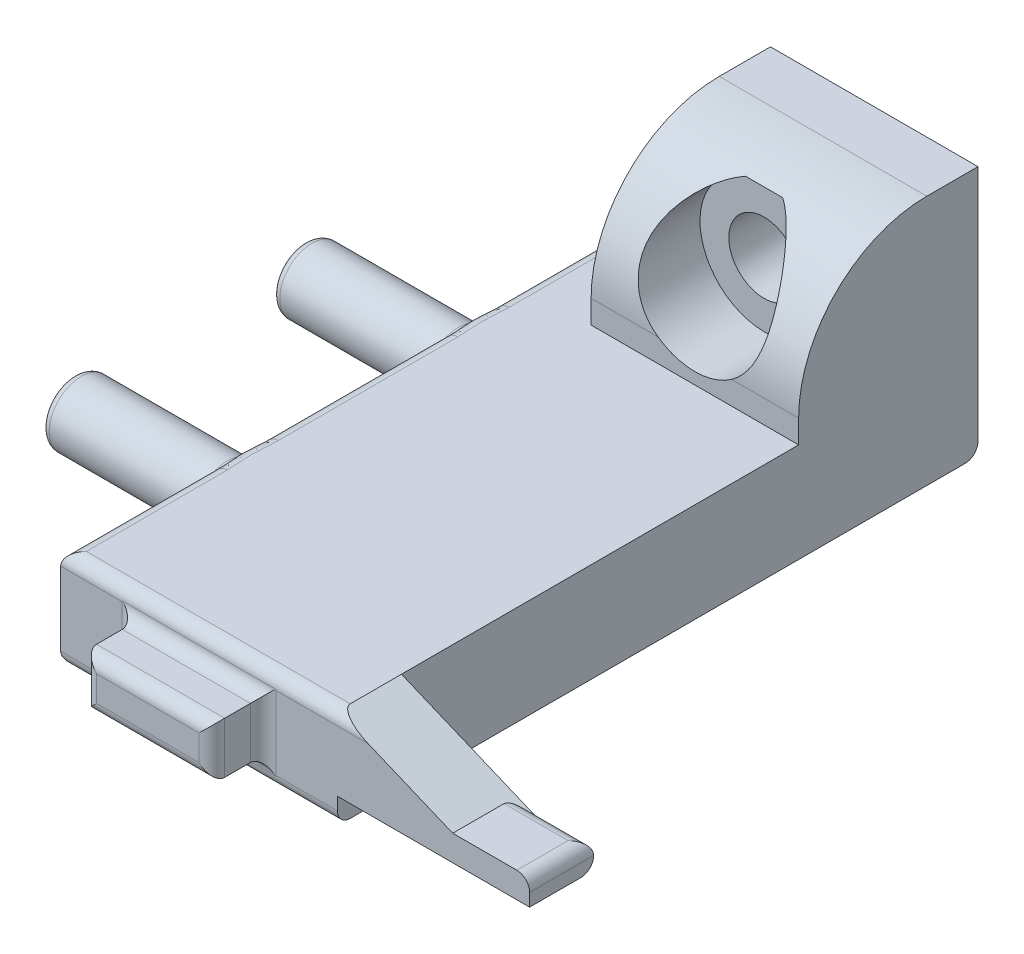
from build123d import *

# Parameters (mm, degrees)
ESQUISSE1_W                                       = 21.6
ESQUISSE1_H                                       = 50
BOSS_EXTRU_1_DEPTH                                = 3.875
BOSS_EXTRU_2_DEPTH                                = 16.2
CHAMBRAGE_POUR_VIS_SIX_PANS_CREUX_M51_D           = 5.5
CHAMBRAGE_POUR_VIS_SIX_PANS_CREUX_M51_CBORE_D     = 10
CHAMBRAGE_POUR_VIS_SIX_PANS_CREUX_M51_CBORE_DEPTH = 5.4
ESQUISSE3_R                                       = 1.125
ENL_V_MAT_EXTRU_1_DEPTH                           = 4
ESQUISSE9_R                                       = 2.5
BOSS_EXTRU_3_DEPTH                                = 13
ESQUISSE10_W                                      = 10
ESQUISSE10_H                                      = 4
BOSS_EXTRU_4_DEPTH                                = 4
ESQUISSE11_W                                      = 5
ESQUISSE11_H                                      = 2
BOSS_EXTRU_5_DEPTH                                = 15
BOSS_EXTRU_6_DEPTH                                = 5
CONG_1_R                                          = 0.6
CONG_2_R                                          = 1
CONG_3_R                                          = 1
CONG_4_R                                          = 1


# Some blends are built 0.0001 mm under size
with BuildPart() as part:
    # Esquisse1 → Boss.-Extru.1 (new, symmetric)
    with BuildSketch(Plane(origin=(0, 0, 0), x_dir=(1, 0, 0), z_dir=(0, 1, 0))):
        Rectangle(ESQUISSE1_W, ESQUISSE1_H)
    extrude(amount=BOSS_EXTRU_1_DEPTH, both=True)

    # Esquisse2 → Boss.-Extru.2 (add)
    with BuildSketch(Plane(origin=(10.8, 0, 0), x_dir=(0, 0, -1), z_dir=(1, 0, 0))):
        with BuildLine():
            Line((25, 3.875), (25, 15.685))
            Line((25, 15.685), (21, 15.685))
            ThreePointArc((21, 15.685), (13.928932188, 12.756067812), (11, 5.685))
            Line((11, 5.685), (11, 3.875))
            Line((11, 3.875), (25, 3.875))
        make_face()
    extrude(amount=-BOSS_EXTRU_2_DEPTH)

    # Chambrage pour vis à six pans creux M51 (through all)
    with Locations(Plane.XY.offset(-11)):
        with Locations((2.7, 9.7795)):
            CounterBoreHole(CHAMBRAGE_POUR_VIS_SIX_PANS_CREUX_M51_D / 2, CHAMBRAGE_POUR_VIS_SIX_PANS_CREUX_M51_CBORE_D / 2, CHAMBRAGE_POUR_VIS_SIX_PANS_CREUX_M51_CBORE_DEPTH)

    # Esquisse3 → Enlèv. mat.-Extru.1 (cut)
    with BuildSketch(Plane(origin=(0, 0, -25), x_dir=(-1, 0, 0), z_dir=(0, 0, -1))):
        with Locations((1.55, 9.7795)):
            Circle(ESQUISSE3_R)
    extrude(amount=-ENL_V_MAT_EXTRU_1_DEPTH, mode=Mode.SUBTRACT)

    # Esquisse9 → Boss.-Extru.3 (add)
    with BuildSketch(Plane.ZY.offset(10.8)):
        with Locations(Location((-7, 0, 0), (0, 0, 180))):
            Circle(ESQUISSE9_R)
        with Locations(Location((11, 0, 0), (0, 0, 180))):
            Circle(ESQUISSE9_R)
    extrude(amount=BOSS_EXTRU_3_DEPTH)

    # Esquisse10 → Boss.-Extru.4 (add)
    with BuildSketch(Plane.XY.offset(25)):
        Rectangle(ESQUISSE10_W, ESQUISSE10_H)
    extrude(amount=BOSS_EXTRU_4_DEPTH)

    # Esquisse11 → Boss.-Extru.5 (add)
    with BuildSketch(Plane(origin=(10.8, 0, 0), x_dir=(0, 0, -1), z_dir=(1, 0, 0))):
        with Locations((-22.5, -0.875)):
            Rectangle(ESQUISSE11_W, ESQUISSE11_H)
    extrude(amount=BOSS_EXTRU_5_DEPTH)

    # Esquisse12 → Boss.-Extru.6 (add)
    with BuildSketch(Plane(origin=(0, 0, 20), x_dir=(-1, 0, 0), z_dir=(0, 0, -1))):
        Polygon((-10.8, 0.125), (-19.8, 0.125), (-10.8, 3.875), align=None)
    extrude(amount=-BOSS_EXTRU_6_DEPTH)

    # Congé1
    cong_1_edges = [part.edges().sort_by_distance(p)[0] for p in [
        (-23.8, 0, -4.5),
        (-23.8, 0, 13.5),
    ]]
    fillet(cong_1_edges, radius=CONG_1_R)

    # Congé2
    cong_2_edges = [part.edges().sort_by_distance(p)[0] for p in [
        (-10.8, 0, -4.5),
        (-10.8, 0, 13.5),
    ]]
    fillet(cong_2_edges, radius=CONG_2_R)

    # Congé3
    cong_3_edges = [part.edges().sort_by_distance(p)[0] for p in [
        (0, -3.875, -25),
        (0, -3.875, 25),
        (0, 3.875, 25),
        (-10.8, -3.875, 0),
        (-10.8, 0, -25),
        (-10.8, 3.875, 0),
        (-8.1, 3.875, -25),
        (25.8, 0.125, 22.5),
        (22.8, 0.125, 20),
        (18.3, -1.875, 20),
    ]]
    fillet(cong_3_edges, radius=CONG_3_R - 0.0001)  # a hair under: the kernel refuses the full size

    # Congé4
    # the kernel refuses this fillet: 1 mm, written as the material it adds along each edge
    with BuildSketch(Plane(origin=(-5, -2, 25), x_dir=(-1, 0, 0), z_dir=(0, 1, 0)), Plane(origin=(5, 2, 25), x_dir=(1, 0, 0), z_dir=(0, -1, 0))) as cong_4_piece_1:
        with BuildLine():
            CenterArc((CONG_4_R, CONG_4_R), CONG_4_R, 180, 90)
            Line((0, CONG_4_R), (-CONG_4_R * 0.02, CONG_4_R))
            Line((-CONG_4_R * 0.02, CONG_4_R), (-CONG_4_R * 0.02, -CONG_4_R * 0.02))
            Line((-CONG_4_R * 0.02, -CONG_4_R * 0.02), (CONG_4_R, -CONG_4_R * 0.02))
            Line((CONG_4_R, -CONG_4_R * 0.02), (CONG_4_R, 0))
        make_face()
    cong_4_piece_1_solid = extrude(amount=4, mode=Mode.PRIVATE)
    with BuildSketch(Plane(origin=(5, -2, 25), x_dir=(0, -0.9999978327920384, -0.0020819248849580653), z_dir=(-1, 0, 0)), Plane(origin=(-5, 2, 25), x_dir=(0, 0.9999978327920382, -0.0020819248849618536), z_dir=(1, 0, 0))) as cong_4_piece_2:
        with BuildLine():
            CenterArc((0.997924036, 0.998175758), CONG_4_R, 180.119285595, 86.419369433)
            Line((-0.002073797, 0.996093833), (-0.10207358, 0.995885641))
            Line((-0.10207358, 0.995885641), (-0.099999783, -0.000208192))
            Line((-0.099999783, -0.000208192), (0.000208192, -0.099999783))
            ThreePointArc((0.000208192, -0.099999783), (0.875306296, -0.098177891), (0.931511397, -0.099817576))
            Line((0.931511397, -0.099817576), (0.937548909, 0))
        make_face()
    cong_4_piece_2_solid = extrude(amount=10, mode=Mode.PRIVATE)
    with BuildSketch(Plane(origin=(5, -2, 25), x_dir=(0, -0.9999978327920384, -0.0020819248849580653), z_dir=(-1, 0, 0))) as cong_4_piece_3a_section:
        with BuildLine():
            CenterArc((0.997924036, 0.998175758), CONG_4_R, 180.119285595, 86.419369433)
            Line((-0.002073797, 0.996093833), (-0.10207358, 0.995885641))
            Line((-0.10207358, 0.995885641), (-0.099999783, -0.000208192))
            Line((-0.099999783, -0.000208192), (0.000208192, -0.099999783))
            ThreePointArc((0.000208192, -0.099999783), (0.875306296, -0.098177891), (0.931511397, -0.099817576))
            Line((0.931511397, -0.099817576), (0.937548909, 0))
        make_face()
    cong_4_piece_3a = extrude(amount=12.49023998, mode=Mode.PRIVATE)
    cong_4_piece_3a = split(cong_4_piece_3a, bisect_by=Plane(origin=(-5, -2.205066251, 25.227606846), z_dir=(-1, 0, 0)), keep=Keep.TOP, mode=Mode.PRIVATE)
    with BuildSketch(Plane(origin=(-5, -4.5, 25), x_dir=(-1, 0, 0), z_dir=(0, 1, 0))) as cong_4_piece_3b_section:
        with BuildLine():
            CenterArc((CONG_4_R, CONG_4_R), CONG_4_R, 180, 90)
            Line((0, CONG_4_R), (-CONG_4_R * 0.02, CONG_4_R))
            Line((-CONG_4_R * 0.02, CONG_4_R), (-CONG_4_R * 0.02, -CONG_4_R * 0.02))
            Line((-CONG_4_R * 0.02, -CONG_4_R * 0.02), (CONG_4_R, -CONG_4_R * 0.02))
            Line((CONG_4_R, -CONG_4_R * 0.02), (CONG_4_R, 0))
        make_face()
    cong_4_piece_3b = extrude(amount=6.5, mode=Mode.PRIVATE)
    cong_4_piece_3b = split(cong_4_piece_3b, bisect_by=Plane(origin=(-5.226395114, -2, 25.226395114), z_dir=(0, -1, 0)), keep=Keep.TOP, mode=Mode.PRIVATE)
    cong_4_piece_3 = cong_4_piece_3a & cong_4_piece_3b
    with BuildSketch(Plane(origin=(-7.49023998, 2, 25), x_dir=(0, 0.9999978327920382, -0.0020819248849618536), z_dir=(1, 0, 0))) as cong_4_piece_4a_section:
        with BuildLine():
            CenterArc((0.997924036, 0.998175758), CONG_4_R, 180.119285595, 86.419369433)
            Line((-0.002073797, 0.996093833), (-0.10207358, 0.995885641))
            Line((-0.10207358, 0.995885641), (-0.099999783, -0.000208192))
            Line((-0.099999783, -0.000208192), (0.000208192, -0.099999783))
            ThreePointArc((0.000208192, -0.099999783), (0.875306296, -0.098177891), (0.931511397, -0.099817576))
            Line((0.931511397, -0.099817576), (0.937548909, 0))
        make_face()
    cong_4_piece_4a = extrude(amount=12.49023998, mode=Mode.PRIVATE)
    cong_4_piece_4a = split(cong_4_piece_4a, bisect_by=Plane(origin=(-5, 2.205066251, 25.227606846), z_dir=(-1, 0, 0)), keep=Keep.TOP, mode=Mode.PRIVATE)
    with BuildSketch(Plane(origin=(-5, -2, 25), x_dir=(-1, 0, 0), z_dir=(0, 1, 0))) as cong_4_piece_4b_section:
        with BuildLine():
            CenterArc((CONG_4_R, CONG_4_R), CONG_4_R, 180, 90)
            Line((0, CONG_4_R), (-CONG_4_R * 0.02, CONG_4_R))
            Line((-CONG_4_R * 0.02, CONG_4_R), (-CONG_4_R * 0.02, -CONG_4_R * 0.02))
            Line((-CONG_4_R * 0.02, -CONG_4_R * 0.02), (CONG_4_R, -CONG_4_R * 0.02))
            Line((CONG_4_R, -CONG_4_R * 0.02), (CONG_4_R, 0))
        make_face()
    cong_4_piece_4b = extrude(amount=6.5, mode=Mode.PRIVATE)
    cong_4_piece_4b = split(cong_4_piece_4b, bisect_by=Plane(origin=(-5.226395114, 2, 25.226395114), z_dir=(0, 1, 0)), keep=Keep.TOP, mode=Mode.PRIVATE)
    cong_4_piece_4 = cong_4_piece_4a & cong_4_piece_4b
    with BuildSketch(Plane(origin=(7.49023998, -2, 25), x_dir=(0, -0.9999978327920382, -0.002081924884961854), z_dir=(-1, 0, 0))) as cong_4_piece_5a_section:
        with BuildLine():
            CenterArc((0.997924036, 0.998175758), CONG_4_R, 180.119285595, 86.419369433)
            Line((-0.002073797, 0.996093833), (-0.10207358, 0.995885641))
            Line((-0.10207358, 0.995885641), (-0.099999783, -0.000208192))
            Line((-0.099999783, -0.000208192), (0.000208192, -0.099999783))
            ThreePointArc((0.000208192, -0.099999783), (0.875306296, -0.098177891), (0.931511397, -0.099817576))
            Line((0.931511397, -0.099817576), (0.937548909, 0))
        make_face()
    cong_4_piece_5a = extrude(amount=12.49023998, mode=Mode.PRIVATE)
    cong_4_piece_5a = split(cong_4_piece_5a, bisect_by=Plane(origin=(5, -2.205066251, 25.227606846), z_dir=(1, 0, 0)), keep=Keep.TOP, mode=Mode.PRIVATE)
    with BuildSketch(Plane(origin=(5, 2, 25), x_dir=(1, 0, 0), z_dir=(0, -1, 0))) as cong_4_piece_5b_section:
        with BuildLine():
            CenterArc((CONG_4_R, CONG_4_R), CONG_4_R, 180, 90)
            Line((0, CONG_4_R), (-CONG_4_R * 0.02, CONG_4_R))
            Line((-CONG_4_R * 0.02, CONG_4_R), (-CONG_4_R * 0.02, -CONG_4_R * 0.02))
            Line((-CONG_4_R * 0.02, -CONG_4_R * 0.02), (CONG_4_R, -CONG_4_R * 0.02))
            Line((CONG_4_R, -CONG_4_R * 0.02), (CONG_4_R, 0))
        make_face()
    cong_4_piece_5b = extrude(amount=6.5, mode=Mode.PRIVATE)
    cong_4_piece_5b = split(cong_4_piece_5b, bisect_by=Plane(origin=(5.226395114, -2, 25.226395114), z_dir=(0, -1, 0)), keep=Keep.TOP, mode=Mode.PRIVATE)
    cong_4_piece_5 = cong_4_piece_5a & cong_4_piece_5b
    with BuildSketch(Plane(origin=(5, 4.5, 25), x_dir=(1, 0, 0), z_dir=(0, -1, 0))) as cong_4_piece_6a_section:
        with BuildLine():
            CenterArc((CONG_4_R, CONG_4_R), CONG_4_R, 180, 90)
            Line((0, CONG_4_R), (-CONG_4_R * 0.02, CONG_4_R))
            Line((-CONG_4_R * 0.02, CONG_4_R), (-CONG_4_R * 0.02, -CONG_4_R * 0.02))
            Line((-CONG_4_R * 0.02, -CONG_4_R * 0.02), (CONG_4_R, -CONG_4_R * 0.02))
            Line((CONG_4_R, -CONG_4_R * 0.02), (CONG_4_R, 0))
        make_face()
    cong_4_piece_6a = extrude(amount=6.5, mode=Mode.PRIVATE)
    cong_4_piece_6a = split(cong_4_piece_6a, bisect_by=Plane(origin=(5.226395114, 2, 25.226395114), z_dir=(0, 1, 0)), keep=Keep.TOP, mode=Mode.PRIVATE)
    with BuildSketch(Plane(origin=(-5, 2, 25), x_dir=(0, 0.9999978327920382, -0.0020819248849618536), z_dir=(1, 0, 0))) as cong_4_piece_6b_section:
        with BuildLine():
            CenterArc((0.997924036, 0.998175758), CONG_4_R, 180.119285595, 86.419369433)
            Line((-0.002073797, 0.996093833), (-0.10207358, 0.995885641))
            Line((-0.10207358, 0.995885641), (-0.099999783, -0.000208192))
            Line((-0.099999783, -0.000208192), (0.000208192, -0.099999783))
            ThreePointArc((0.000208192, -0.099999783), (0.875306296, -0.098177891), (0.931511397, -0.099817576))
            Line((0.931511397, -0.099817576), (0.937548909, 0))
        make_face()
    cong_4_piece_6b = extrude(amount=12.49023998, mode=Mode.PRIVATE)
    cong_4_piece_6b = split(cong_4_piece_6b, bisect_by=Plane(origin=(5, 2.205066251, 25.227606846), z_dir=(1, 0, 0)), keep=Keep.TOP, mode=Mode.PRIVATE)
    cong_4_piece_6 = cong_4_piece_6a & cong_4_piece_6b
    add([cong_4_piece_1_solid, cong_4_piece_2_solid, cong_4_piece_3, cong_4_piece_4, cong_4_piece_5, cong_4_piece_6])
    # the kernel refuses this fillet: 1 mm, written as the material it takes off along each edge
    with BuildSketch(Plane(origin=(-5, -2, 29), x_dir=(0, 0, -1), z_dir=(0, 1, 0))) as cong_4_2_piece_1:
        with BuildLine():
            CenterArc((CONG_4_R, -CONG_4_R), CONG_4_R, 90, 90)
            Line((0, -CONG_4_R), (-CONG_4_R * 0.02, -CONG_4_R))
            Line((-CONG_4_R * 0.02, -CONG_4_R), (-CONG_4_R * 0.02, CONG_4_R * 0.02))
            Line((-CONG_4_R * 0.02, CONG_4_R * 0.02), (CONG_4_R, CONG_4_R * 0.02))
            Line((CONG_4_R, CONG_4_R * 0.02), (CONG_4_R, 0))
        make_face()
    cong_4_2_piece_1_solid = extrude(amount=4, mode=Mode.PRIVATE)
    with BuildSketch(Plane(origin=(5, -2, 29), x_dir=(0, 1, 0), z_dir=(-1, 0, 0))) as cong_4_2_piece_2:
        with BuildLine():
            CenterArc((CONG_4_R, CONG_4_R), CONG_4_R, 180, 90)
            Line((0, CONG_4_R), (-CONG_4_R * 0.02, CONG_4_R))
            Line((-CONG_4_R * 0.02, CONG_4_R), (-CONG_4_R * 0.02, -CONG_4_R * 0.02))
            Line((-CONG_4_R * 0.02, -CONG_4_R * 0.02), (CONG_4_R, -CONG_4_R * 0.02))
            Line((CONG_4_R, -CONG_4_R * 0.02), (CONG_4_R, 0))
        make_face()
    cong_4_2_piece_2_solid = extrude(amount=10, mode=Mode.PRIVATE)
    with BuildSketch(Plane(origin=(5, 2, 29), x_dir=(-1, 0, 0), z_dir=(0, -1, 0))) as cong_4_2_piece_3:
        with BuildLine():
            CenterArc((CONG_4_R, CONG_4_R), CONG_4_R, 180, 90)
            Line((0, CONG_4_R), (-CONG_4_R * 0.02, CONG_4_R))
            Line((-CONG_4_R * 0.02, CONG_4_R), (-CONG_4_R * 0.02, -CONG_4_R * 0.02))
            Line((-CONG_4_R * 0.02, -CONG_4_R * 0.02), (CONG_4_R, -CONG_4_R * 0.02))
            Line((CONG_4_R, -CONG_4_R * 0.02), (CONG_4_R, 0))
        make_face()
    cong_4_2_piece_3_solid = extrude(amount=4, mode=Mode.PRIVATE)
    with BuildSketch(Plane(origin=(-5, 2, 29), x_dir=(0, 0, -1), z_dir=(1, 0, 0))) as cong_4_2_piece_4:
        with BuildLine():
            CenterArc((CONG_4_R, -CONG_4_R), CONG_4_R, 90, 90)
            Line((0, -CONG_4_R), (-CONG_4_R * 0.02, -CONG_4_R))
            Line((-CONG_4_R * 0.02, -CONG_4_R), (-CONG_4_R * 0.02, CONG_4_R * 0.02))
            Line((-CONG_4_R * 0.02, CONG_4_R * 0.02), (CONG_4_R, CONG_4_R * 0.02))
            Line((CONG_4_R, CONG_4_R * 0.02), (CONG_4_R, 0))
        make_face()
    cong_4_2_piece_4_solid = extrude(amount=10, mode=Mode.PRIVATE)
    with BuildSketch(Plane(origin=(-5, -4.5, 29), x_dir=(0, 0, -1), z_dir=(0, 1, 0))) as cong_4_2_piece_5a_section:
        with BuildLine():
            CenterArc((CONG_4_R, -CONG_4_R), CONG_4_R, 90, 90)
            Line((0, -CONG_4_R), (-CONG_4_R * 0.02, -CONG_4_R))
            Line((-CONG_4_R * 0.02, -CONG_4_R), (-CONG_4_R * 0.02, CONG_4_R * 0.02))
            Line((-CONG_4_R * 0.02, CONG_4_R * 0.02), (CONG_4_R, CONG_4_R * 0.02))
            Line((CONG_4_R, CONG_4_R * 0.02), (CONG_4_R, 0))
        make_face()
    cong_4_2_piece_5a = extrude(amount=6.5, mode=Mode.PRIVATE)
    cong_4_2_piece_5a = split(cong_4_2_piece_5a, bisect_by=Plane(origin=(-4.773604886, -2, 28.773604886), z_dir=(0, -1, 0)), keep=Keep.TOP, mode=Mode.PRIVATE)
    with BuildSketch(Plane(origin=(5, -2, 29), x_dir=(0, 1, 0), z_dir=(-1, 0, 0))) as cong_4_2_piece_5b_section:
        with BuildLine():
            CenterArc((CONG_4_R, CONG_4_R), CONG_4_R, 180, 90)
            Line((0, CONG_4_R), (-CONG_4_R * 0.02, CONG_4_R))
            Line((-CONG_4_R * 0.02, CONG_4_R), (-CONG_4_R * 0.02, -CONG_4_R * 0.02))
            Line((-CONG_4_R * 0.02, -CONG_4_R * 0.02), (CONG_4_R, -CONG_4_R * 0.02))
            Line((CONG_4_R, -CONG_4_R * 0.02), (CONG_4_R, 0))
        make_face()
    cong_4_2_piece_5b = extrude(amount=12.5, mode=Mode.PRIVATE)
    cong_4_2_piece_5b = split(cong_4_2_piece_5b, bisect_by=Plane(origin=(-5, -1.773604886, 28.773604886), z_dir=(-1, 0, 0)), keep=Keep.TOP, mode=Mode.PRIVATE)
    cong_4_2_piece_5 = cong_4_2_piece_5a & cong_4_2_piece_5b
    with BuildSketch(Plane(origin=(-7.5, 2, 29), x_dir=(0, 0, -1), z_dir=(1, 0, 0))) as cong_4_2_piece_6a_section:
        with BuildLine():
            CenterArc((CONG_4_R, -CONG_4_R), CONG_4_R, 90, 90)
            Line((0, -CONG_4_R), (-CONG_4_R * 0.02, -CONG_4_R))
            Line((-CONG_4_R * 0.02, -CONG_4_R), (-CONG_4_R * 0.02, CONG_4_R * 0.02))
            Line((-CONG_4_R * 0.02, CONG_4_R * 0.02), (CONG_4_R, CONG_4_R * 0.02))
            Line((CONG_4_R, CONG_4_R * 0.02), (CONG_4_R, 0))
        make_face()
    cong_4_2_piece_6a = extrude(amount=12.5, mode=Mode.PRIVATE)
    cong_4_2_piece_6a = split(cong_4_2_piece_6a, bisect_by=Plane(origin=(-5, 1.773604886, 28.773604886), z_dir=(-1, 0, 0)), keep=Keep.TOP, mode=Mode.PRIVATE)
    with BuildSketch(Plane(origin=(-5, -2, 29), x_dir=(0, 0, -1), z_dir=(0, 1, 0))) as cong_4_2_piece_6b_section:
        with BuildLine():
            CenterArc((CONG_4_R, -CONG_4_R), CONG_4_R, 90, 90)
            Line((0, -CONG_4_R), (-CONG_4_R * 0.02, -CONG_4_R))
            Line((-CONG_4_R * 0.02, -CONG_4_R), (-CONG_4_R * 0.02, CONG_4_R * 0.02))
            Line((-CONG_4_R * 0.02, CONG_4_R * 0.02), (CONG_4_R, CONG_4_R * 0.02))
            Line((CONG_4_R, CONG_4_R * 0.02), (CONG_4_R, 0))
        make_face()
    cong_4_2_piece_6b = extrude(amount=6.5, mode=Mode.PRIVATE)
    cong_4_2_piece_6b = split(cong_4_2_piece_6b, bisect_by=Plane(origin=(-4.773604886, 2, 28.773604886), z_dir=(0, 1, 0)), keep=Keep.TOP, mode=Mode.PRIVATE)
    cong_4_2_piece_6 = cong_4_2_piece_6a & cong_4_2_piece_6b
    with BuildSketch(Plane(origin=(7.5, -2, 29), x_dir=(0, 1, 0), z_dir=(-1, 0, 0))) as cong_4_2_piece_7a_section:
        with BuildLine():
            CenterArc((CONG_4_R, CONG_4_R), CONG_4_R, 180, 90)
            Line((0, CONG_4_R), (-CONG_4_R * 0.02, CONG_4_R))
            Line((-CONG_4_R * 0.02, CONG_4_R), (-CONG_4_R * 0.02, -CONG_4_R * 0.02))
            Line((-CONG_4_R * 0.02, -CONG_4_R * 0.02), (CONG_4_R, -CONG_4_R * 0.02))
            Line((CONG_4_R, -CONG_4_R * 0.02), (CONG_4_R, 0))
        make_face()
    cong_4_2_piece_7a = extrude(amount=12.5, mode=Mode.PRIVATE)
    cong_4_2_piece_7a = split(cong_4_2_piece_7a, bisect_by=Plane(origin=(5, -1.773604886, 28.773604886), z_dir=(1, 0, 0)), keep=Keep.TOP, mode=Mode.PRIVATE)
    with BuildSketch(Plane(origin=(5, 2, 29), x_dir=(-1, 0, 0), z_dir=(0, -1, 0))) as cong_4_2_piece_7b_section:
        with BuildLine():
            CenterArc((CONG_4_R, CONG_4_R), CONG_4_R, 180, 90)
            Line((0, CONG_4_R), (-CONG_4_R * 0.02, CONG_4_R))
            Line((-CONG_4_R * 0.02, CONG_4_R), (-CONG_4_R * 0.02, -CONG_4_R * 0.02))
            Line((-CONG_4_R * 0.02, -CONG_4_R * 0.02), (CONG_4_R, -CONG_4_R * 0.02))
            Line((CONG_4_R, -CONG_4_R * 0.02), (CONG_4_R, 0))
        make_face()
    cong_4_2_piece_7b = extrude(amount=6.5, mode=Mode.PRIVATE)
    cong_4_2_piece_7b = split(cong_4_2_piece_7b, bisect_by=Plane(origin=(4.773604886, -2, 28.773604886), z_dir=(0, -1, 0)), keep=Keep.TOP, mode=Mode.PRIVATE)
    cong_4_2_piece_7 = cong_4_2_piece_7a & cong_4_2_piece_7b
    with BuildSketch(Plane(origin=(-5, 2, 29), x_dir=(0, 0, -1), z_dir=(1, 0, 0))) as cong_4_2_piece_8a_section:
        with BuildLine():
            CenterArc((CONG_4_R, -CONG_4_R), CONG_4_R, 90, 90)
            Line((0, -CONG_4_R), (-CONG_4_R * 0.02, -CONG_4_R))
            Line((-CONG_4_R * 0.02, -CONG_4_R), (-CONG_4_R * 0.02, CONG_4_R * 0.02))
            Line((-CONG_4_R * 0.02, CONG_4_R * 0.02), (CONG_4_R, CONG_4_R * 0.02))
            Line((CONG_4_R, CONG_4_R * 0.02), (CONG_4_R, 0))
        make_face()
    cong_4_2_piece_8a = extrude(amount=12.5, mode=Mode.PRIVATE)
    cong_4_2_piece_8a = split(cong_4_2_piece_8a, bisect_by=Plane(origin=(5, 1.773604886, 28.773604886), z_dir=(1, 0, 0)), keep=Keep.TOP, mode=Mode.PRIVATE)
    with BuildSketch(Plane(origin=(5, 4.5, 29), x_dir=(-1, 0, 0), z_dir=(0, -1, 0))) as cong_4_2_piece_8b_section:
        with BuildLine():
            CenterArc((CONG_4_R, CONG_4_R), CONG_4_R, 180, 90)
            Line((0, CONG_4_R), (-CONG_4_R * 0.02, CONG_4_R))
            Line((-CONG_4_R * 0.02, CONG_4_R), (-CONG_4_R * 0.02, -CONG_4_R * 0.02))
            Line((-CONG_4_R * 0.02, -CONG_4_R * 0.02), (CONG_4_R, -CONG_4_R * 0.02))
            Line((CONG_4_R, -CONG_4_R * 0.02), (CONG_4_R, 0))
        make_face()
    cong_4_2_piece_8b = extrude(amount=6.5, mode=Mode.PRIVATE)
    cong_4_2_piece_8b = split(cong_4_2_piece_8b, bisect_by=Plane(origin=(4.773604886, 2, 28.773604886), z_dir=(0, 1, 0)), keep=Keep.TOP, mode=Mode.PRIVATE)
    cong_4_2_piece_8 = cong_4_2_piece_8a & cong_4_2_piece_8b
    add([cong_4_2_piece_1_solid, cong_4_2_piece_2_solid, cong_4_2_piece_3_solid, cong_4_2_piece_4_solid, cong_4_2_piece_5, cong_4_2_piece_6, cong_4_2_piece_7, cong_4_2_piece_8], mode=Mode.SUBTRACT)


solid = part.part
